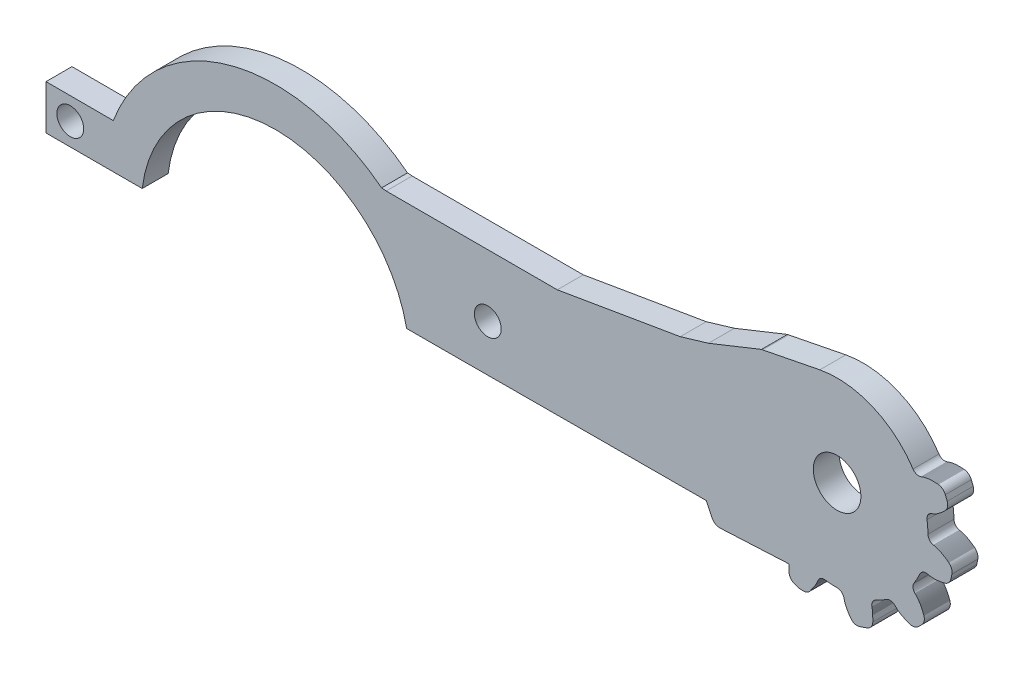
from build123d import *

# Parameters (mm, degrees)
MODEL_R         = 1.55
EXTRUDE_3_DEPTH = 3


with BuildPart() as part:
    # Model → 凸台-拉伸3 (new body)
    with BuildSketch(Plane.XY):
        with BuildLine():
            Line((3158.977966711, 1766.810791231), (3159.006533739, 1766.840009937))
            Line((3159.006533739, 1766.840009937), (3159.034921501, 1766.869406555))
            ThreePointArc((3159.034921501, 1766.869406555), (3159.291052878, 1767.351449245), (3159.255884769, 1767.896180042))
            ThreePointArc((3159.255884769, 1767.896180042), (3159.153973649, 1768.173760338), (3159.046007365, 1768.449041974))
            ThreePointArc((3159.046007365, 1768.449041974), (3158.710829011, 1768.879882905), (3158.199335085, 1769.070519737))
            Line((3158.199335085, 1769.070519737), (3158.15859093, 1769.073672502))
            Line((3158.15859093, 1769.073672502), (3158.117830731, 1769.076573212))
            Line((3158.117830731, 1769.076573212), (3158.077056286, 1769.079221517))
            Line((3158.077056286, 1769.079221517), (3158.036268646, 1769.081615765))
            Line((3158.036268646, 1769.081615765), (3157.995468742, 1769.083754099))
            Line((3157.995468742, 1769.083754099), (3157.954657508, 1769.085634662))
            Line((3157.954657508, 1769.085634662), (3157.913835876, 1769.087255598))
            Line((3157.913835876, 1769.087255598), (3157.873004779, 1769.088615048))
            Line((3157.873004779, 1769.088615048), (3157.832165149, 1769.089711156))
            Line((3157.832165149, 1769.089711156), (3157.791317919, 1769.090542065))
            Line((3157.791317919, 1769.090542065), (3157.750464022, 1769.091105918))
            Line((3157.750464022, 1769.091105918), (3157.70960439, 1769.091400858))
            Line((3157.70960439, 1769.091400858), (3157.668739956, 1769.091425028))
            Line((3157.668739956, 1769.091425028), (3157.627871653, 1769.091176571))
            Line((3157.627871653, 1769.091176571), (3157.587000413, 1769.090653629))
            Line((3157.587000413, 1769.090653629), (3157.546127169, 1769.089854346))
            Line((3157.546127169, 1769.089854346), (3157.505252853, 1769.088776865))
            Line((3157.505252853, 1769.088776865), (3157.464378398, 1769.087419329))
            Line((3157.464378398, 1769.087419329), (3157.423505499, 1769.085777687))
            Line((3157.423505499, 1769.085777687), (3157.38263957, 1769.083837181))
            Line((3157.38263957, 1769.083837181), (3157.341787157, 1769.081579793))
            Line((3157.341787157, 1769.081579793), (3157.300954807, 1769.078987503))
            Line((3157.300954807, 1769.078987503), (3157.260149068, 1769.076042291))
            Line((3157.260149068, 1769.076042291), (3157.219376487, 1769.072726138))
            Line((3157.219376487, 1769.072726138), (3157.178643611, 1769.069021024))
            Line((3157.178643611, 1769.069021024), (3157.137956986, 1769.064908929))
            Line((3157.137956986, 1769.064908929), (3157.09732316, 1769.060371834))
            Line((3157.09732316, 1769.060371834), (3157.05674868, 1769.055391718))
            Line((3157.05674868, 1769.055391718), (3157.016240094, 1769.049950563))
            Line((3157.016240094, 1769.049950563), (3156.975803947, 1769.044030348))
            Line((3156.975803947, 1769.044030348), (3156.935446787, 1769.037613055))
            Line((3156.935446787, 1769.037613055), (3156.895175162, 1769.030680662))
            Line((3156.895175162, 1769.030680662), (3156.854995618, 1769.023215151))
            Line((3156.854995618, 1769.023215151), (3156.814914695, 1769.015198994))
            Line((3156.814914695, 1769.015198994), (3156.774938772, 1769.006627541))
            Line((3156.774938772, 1769.006627541), (3156.735074048, 1768.99750997))
            Line((3156.735074048, 1768.99750997), (3156.695326716, 1768.987856136))
            Line((3156.695326716, 1768.987856136), (3156.655702967, 1768.977675895))
            Line((3156.655702967, 1768.977675895), (3156.616208993, 1768.966979103))
            Line((3156.616208993, 1768.966979103), (3156.576850986, 1768.955775615))
            Line((3156.576850986, 1768.955775615), (3156.537635139, 1768.944075289))
            Line((3156.537635139, 1768.944075289), (3156.498567642, 1768.931887979))
            Line((3156.498567642, 1768.931887979), (3156.459654689, 1768.919223542))
            Line((3156.459654689, 1768.919223542), (3156.420902471, 1768.906091834))
            Line((3156.420902471, 1768.906091834), (3156.382317179, 1768.89250271))
            Line((3156.382317179, 1768.89250271), (3156.343905007, 1768.878466027))
            Line((3156.343905007, 1768.878466027), (3156.305672145, 1768.863991641))
            Line((3156.305672145, 1768.863991641), (3156.267624786, 1768.849089407))
            ThreePointArc((3156.267624786, 1768.849089407), (3156.102552627, 1768.803156848), (3155.931480169, 1768.793521929))
            ThreePointArc((3155.931480169, 1768.793521929), (3155.575765967, 1768.898024759), (3155.305665417, 1769.151991542))
            ThreePointArc((3155.305665417, 1769.151991542), (3150.611697753, 1773.057874001), (3144.538148034, 1773.691312259))
            Line((3144.538148034, 1773.691312259), (3137.923574677, 1772.38248648))
            ThreePointArc((3137.923574677, 1772.38248648), (3137.862754185, 1772.372389298), (3137.801427059, 1772.366059292))
            Line((3137.801427059, 1772.366059292), (3131.669869487, 1769.91654616))
            Line((3131.669869487, 1769.91654616), (3128.4128753, 1768.946597823))
            Line((3128.4128753, 1768.946597823), (3114.205961715, 1766.532320414))
            Line((3114.205961715, 1766.532320414), (3094.433280611, 1766.532320414))
            Line((3094.433280611, 1766.532320414), (3093.904446802, 1766.580993594))
            ThreePointArc((3093.904446802, 1766.580993594), (3076.188230883, 1770.035752188), (3062.904521532, 1757.815165898))
            Line((3062.904521532, 1757.815165898), (3055.130304412, 1757.827990225))
            Line((3055.130304412, 1757.827990225), (3055.130304412, 1752.685054998))
            Line((3055.130304412, 1752.685054998), (3061.720181249, 1752.685054998))
            Line((3061.720181249, 1752.685054998), (3066.246469955, 1752.685054998))
            ThreePointArc((3066.246469955, 1752.685054998), (3080.986097034, 1766.276983296), (3096.803522292, 1753.956018257))
            Line((3096.803522292, 1753.956018257), (3101.378030798, 1753.956522823))
            Line((3101.378030798, 1753.956522823), (3131.421318555, 1754.049099647))
            Line((3131.421318555, 1754.049099647), (3132.145372205, 1752.548482232))
            ThreePointArc((3132.145372205, 1752.548482232), (3132.484712735, 1752.225716316), (3132.933796063, 1752.092847974))
            ThreePointArc((3132.933796063, 1752.092847974), (3132.984313262, 1752.091532482), (3133.034832414, 1752.09277068))
            Line((3133.034832414, 1752.09277068), (3140.958950813, 1752.487535322))
            Line((3140.958950813, 1752.487535322), (3140.958059775, 1752.467097369))
            Line((3140.958059775, 1752.467097369), (3140.956594717, 1752.426211634))
            Line((3140.956594717, 1752.426211634), (3140.955428582, 1752.385322405))
            Line((3140.955428582, 1752.385322405), (3140.954546553, 1752.344434926))
            Line((3140.954546553, 1752.344434926), (3140.953944558, 1752.303550842))
            Line((3140.953944558, 1752.303550842), (3140.953620731, 1752.262671066))
            Line((3140.953620731, 1752.262671066), (3140.953573202, 1752.221796509))
            Line((3140.953573202, 1752.221796509), (3140.953800105, 1752.18092808))
            Line((3140.953800105, 1752.18092808), (3140.954299572, 1752.140066691))
            Line((3140.954299572, 1752.140066691), (3140.955069734, 1752.099213254))
            Line((3140.955069734, 1752.099213254), (3140.956108725, 1752.058368678))
            Line((3140.956108725, 1752.058368678), (3140.957414677, 1752.017533876))
            Line((3140.957414677, 1752.017533876), (3140.958985721, 1751.976709758))
            Line((3140.958985721, 1751.976709758), (3140.96081999, 1751.935897234))
            Line((3140.96081999, 1751.935897234), (3140.962915616, 1751.895097217))
            Line((3140.962915616, 1751.895097217), (3140.965270732, 1751.854310617))
            Line((3140.965270732, 1751.854310617), (3140.967883469, 1751.813538344))
            Line((3140.967883469, 1751.813538344), (3140.970751961, 1751.77278131))
            Line((3140.970751961, 1751.77278131), (3140.973874338, 1751.732040426))
            Line((3140.973874338, 1751.732040426), (3140.977248938, 1751.691316723))
            Line((3140.977248938, 1751.691316723), (3140.980875389, 1751.650611994))
            ThreePointArc((3140.980875389, 1751.650611994), (3141.177448565, 1751.141369985), (3141.612158847, 1750.811225459))
            ThreePointArc((3141.612158847, 1750.811225459), (3141.850146516, 1750.720651457), (3142.089800203, 1750.634582354))
            ThreePointArc((3142.089800203, 1750.634582354), (3142.344045808, 1750.620406585), (3142.59851356, 1750.611028772))
            ThreePointArc((3142.59851356, 1750.611028772), (3143.127538852, 1750.745567532), (3143.507096024, 1751.137874542))
            Line((3143.507096024, 1751.137874542), (3144.011634077, 1751.854069451))
            Line((3144.011634077, 1751.854069451), (3144.030843181, 1751.890139335))
            Line((3144.030843181, 1751.890139335), (3144.04982776, 1751.92632488))
            Line((3144.04982776, 1751.92632488), (3144.068586774, 1751.96262458))
            Line((3144.068586774, 1751.96262458), (3144.087118288, 1751.999038136))
            Line((3144.087118288, 1751.999038136), (3144.105420227, 1752.035565435))
            Line((3144.105420227, 1752.035565435), (3144.123490517, 1752.072206369))
            Line((3144.123490517, 1752.072206369), (3144.141327081, 1752.108960825))
            Line((3144.141327081, 1752.108960825), (3144.158927846, 1752.145828693))
            Line((3144.158927846, 1752.145828693), (3144.176290735, 1752.182809862))
            Line((3144.176290735, 1752.182809862), (3144.193413674, 1752.219904222))
            Line((3144.193413674, 1752.219904222), (3144.210294587, 1752.257111662))
            Line((3144.210294587, 1752.257111662), (3144.2269314, 1752.294432072))
            Line((3144.2269314, 1752.294432072), (3144.243322037, 1752.33186534))
            Line((3144.243322037, 1752.33186534), (3144.259464423, 1752.369411356))
            Line((3144.259464423, 1752.369411356), (3144.275356484, 1752.407070009))
            Line((3144.275356484, 1752.407070009), (3144.290996143, 1752.444841189))
            Line((3144.290996143, 1752.444841189), (3144.306381326, 1752.482724784))
            Line((3144.306381326, 1752.482724784), (3144.321509959, 1752.520720684))
            Line((3144.321509959, 1752.520720684), (3144.328943804, 1752.539774822))
            ThreePointArc((3144.328943804, 1752.539774822), (3144.668940877, 1752.888173571), (3145.148081398, 1752.974220412))
            ThreePointArc((3145.148081398, 1752.974220412), (3145.570425083, 1752.926708994), (3145.994345511, 1752.896328167))
            ThreePointArc((3145.994345511, 1752.896328167), (3146.269233955, 1752.885821127), (3146.54430331, 1752.88251887))
            ThreePointArc((3146.54430331, 1752.88251887), (3147.04876035, 1752.70355742), (3147.326650652, 1752.246084922))
            Line((3147.326650652, 1752.246084922), (3147.335149498, 1752.206116839))
            Line((3147.335149498, 1752.206116839), (3147.344107656, 1752.16622936))
            Line((3147.344107656, 1752.16622936), (3147.353529947, 1752.12643308))
            Line((3147.353529947, 1752.12643308), (3147.363421192, 1752.086738593))
            Line((3147.363421192, 1752.086738593), (3147.373786212, 1752.047156495))
            Line((3147.373786212, 1752.047156495), (3147.384629827, 1752.007697378))
            Line((3147.384629827, 1752.007697378), (3147.395956859, 1751.968371837))
            Line((3147.395956859, 1751.968371837), (3147.407772127, 1751.929190467))
            Line((3147.407772127, 1751.929190467), (3147.420080454, 1751.890163862))
            Line((3147.420080454, 1751.890163862), (3147.43288666, 1751.851302616))
            Line((3147.43288666, 1751.851302616), (3147.446195565, 1751.812617323))
            Line((3147.446195565, 1751.812617323), (3147.460011991, 1751.774118579))
            Line((3147.460011991, 1751.774118579), (3147.474340758, 1751.735816976))
            Line((3147.474340758, 1751.735816976), (3147.489186687, 1751.69772311))
            Line((3147.489186687, 1751.69772311), (3147.504554027, 1751.659847208))
            Line((3147.504554027, 1751.659847208), (3147.520435386, 1751.622192035))
            Line((3147.520435386, 1751.622192035), (3147.536812532, 1751.584753406))
            Line((3147.536812532, 1751.584753406), (3147.553666814, 1751.547526867))
            Line((3147.553666814, 1751.547526867), (3147.570979586, 1751.510507969))
            Line((3147.570979586, 1751.510507969), (3147.588732199, 1751.473692259))
            Line((3147.588732199, 1751.473692259), (3147.606906004, 1751.437075285))
            Line((3147.606906004, 1751.437075285), (3147.625482354, 1751.400652596))
            Line((3147.625482354, 1751.400652596), (3147.6444426, 1751.364419741))
            Line((3147.6444426, 1751.364419741), (3147.663768095, 1751.328372267))
            Line((3147.663768095, 1751.328372267), (3147.683440189, 1751.292505723))
            Line((3147.683440189, 1751.292505723), (3147.703440235, 1751.256815658))
            Line((3147.703440235, 1751.256815658), (3147.723749584, 1751.22129762))
            Line((3147.723749584, 1751.22129762), (3147.744349589, 1751.185947157))
            Line((3147.744349589, 1751.185947157), (3147.765221601, 1751.150759817))
            Line((3147.765221601, 1751.150759817), (3147.786346972, 1751.115731149))
            Line((3147.786346972, 1751.115731149), (3147.807710402, 1751.080857552))
            Line((3147.807710402, 1751.080857552), (3147.829307576, 1751.046138209))
            Line((3147.829307576, 1751.046138209), (3147.85113643, 1751.011572879))
            Line((3147.85113643, 1751.011572879), (3147.873194901, 1750.977161317))
            Line((3147.873194901, 1750.977161317), (3147.895480925, 1750.94290328))
            Line((3147.895480925, 1750.94290328), (3147.917992437, 1750.908798524))
            Line((3147.917992437, 1750.908798524), (3147.940727375, 1750.874846807))
            Line((3147.940727375, 1750.874846807), (3147.963683675, 1750.841047885))
            Line((3147.963683675, 1750.841047885), (3147.986859272, 1750.807401513))
            Line((3147.986859272, 1750.807401513), (3148.010252103, 1750.77390745))
            Line((3148.010252103, 1750.77390745), (3148.033860104, 1750.740565451))
            Line((3148.033860104, 1750.740565451), (3148.057681212, 1750.707375274))
            Line((3148.057681212, 1750.707375274), (3148.081713362, 1750.674336674))
            Line((3148.081713362, 1750.674336674), (3148.105954492, 1750.641449408))
            Line((3148.105954492, 1750.641449408), (3148.130402536, 1750.608713233))
            Line((3148.130402536, 1750.608713233), (3148.155055432, 1750.576127905))
            Line((3148.155055432, 1750.576127905), (3148.179911222, 1750.543693393))
            Line((3148.179911222, 1750.543693393), (3148.204968625, 1750.511411002))
            ThreePointArc((3148.204968625, 1750.511411002), (3148.244535938, 1750.463866673), (3148.286967004, 1750.41885956))
            ThreePointArc((3148.286967004, 1750.41885956), (3148.693644721, 1750.264769442), (3149.127278, 1750.297825584))
            ThreePointArc((3149.127278, 1750.297825584), (3149.574723168, 1750.442751618), (3150.01666422, 1750.603682786))
            ThreePointArc((3150.01666422, 1750.603682786), (3150.477300798, 1750.96214444), (3150.659076592, 1751.516796019))
            Line((3150.659076592, 1751.516796019), (3150.650449261, 1752.243553298))
            Line((3150.650449261, 1752.243553298), (3150.649892313, 1752.280948133))
            Line((3150.649892313, 1752.280948133), (3150.648761732, 1752.321796434))
            Line((3150.648761732, 1752.321796434), (3150.647090355, 1752.362629461))
            Line((3150.647090355, 1752.362629461), (3150.6448599, 1752.403443236))
            Line((3150.6448599, 1752.403443236), (3150.64206486, 1752.444232107))
            Line((3150.64206486, 1752.444232107), (3150.638713434, 1752.484988631))
            Line((3150.638713434, 1752.484988631), (3150.634814498, 1752.525705276))
            Line((3150.634814498, 1752.525705276), (3150.630376924, 1752.566374512))
            Line((3150.630376924, 1752.566374512), (3150.625409588, 1752.606988807))
            Line((3150.625409588, 1752.606988807), (3150.619921364, 1752.647540628))
            Line((3150.619921364, 1752.647540628), (3150.613921127, 1752.688022445))
            Line((3150.613921127, 1752.688022445), (3150.607417751, 1752.728426726))
            Line((3150.607417751, 1752.728426726), (3150.600420111, 1752.768745938))
            Line((3150.600420111, 1752.768745938), (3150.59293708, 1752.808972552))
            Line((3150.59293708, 1752.808972552), (3150.584977534, 1752.849099035))
            Line((3150.584977534, 1752.849099035), (3150.576550346, 1752.889117855))
            Line((3150.576550346, 1752.889117855), (3150.567664391, 1752.929021481))
            Line((3150.567664391, 1752.929021481), (3150.558328544, 1752.968802382))
            ThreePointArc((3150.558328544, 1752.968802382), (3150.614878504, 1753.501067548), (3150.995048665, 1753.877862924))
            ThreePointArc((3150.995048665, 1753.877862924), (3151.618427289, 1754.196304046), (3152.219202878, 1754.555573233))
            ThreePointArc((3152.219202878, 1754.555573233), (3152.74033301, 1754.677751347), (3153.221437513, 1754.443139833))
            Line((3153.221437513, 1754.443139833), (3153.250195575, 1754.414111364))
            Line((3153.250195575, 1754.414111364), (3153.279296456, 1754.385399028))
            Line((3153.279296456, 1754.385399028), (3153.308738485, 1754.357014342))
            Line((3153.308738485, 1754.357014342), (3153.33851999, 1754.328968826))
            Line((3153.33851999, 1754.328968826), (3153.368639297, 1754.301273998))
            Line((3153.368639297, 1754.301273998), (3153.399094736, 1754.273941377))
            Line((3153.399094736, 1754.273941377), (3153.429884634, 1754.246982483))
            Line((3153.429884634, 1754.246982483), (3153.461007318, 1754.220408833))
            Line((3153.461007318, 1754.220408833), (3153.492461117, 1754.194231948))
            Line((3153.492461117, 1754.194231948), (3153.524244359, 1754.168463345))
            Line((3153.524244359, 1754.168463345), (3153.55635537, 1754.143114543))
            Line((3153.55635537, 1754.143114543), (3153.58879248, 1754.118197062))
            Line((3153.58879248, 1754.118197062), (3153.621554016, 1754.09372242))
            Line((3153.621554016, 1754.09372242), (3153.654638305, 1754.069702136))
            Line((3153.654638305, 1754.069702136), (3153.688043392, 1754.046147111))
            Line((3153.688043392, 1754.046147111), (3153.721761566, 1754.023055675))
            Line((3153.721761566, 1754.023055675), (3153.755779748, 1754.000414448))
            Line((3153.755779748, 1754.000414448), (3153.790084659, 1753.978209605))
            Line((3153.790084659, 1753.978209605), (3153.824663017, 1753.956427317))
            Line((3153.824663017, 1753.956427317), (3153.859501541, 1753.935053757))
            Line((3153.859501541, 1753.935053757), (3153.89458695, 1753.9140751))
            Line((3153.89458695, 1753.9140751), (3153.929905962, 1753.893477517))
            Line((3153.929905962, 1753.893477517), (3153.965445297, 1753.873247183))
            Line((3153.965445297, 1753.873247183), (3154.001191673, 1753.853370269))
            Line((3154.001191673, 1753.853370269), (3154.037131809, 1753.83383295))
            Line((3154.037131809, 1753.83383295), (3154.073252424, 1753.814621397))
            Line((3154.073252424, 1753.814621397), (3154.109540238, 1753.795721785))
            Line((3154.109540238, 1753.795721785), (3154.145981968, 1753.777120287))
            Line((3154.145981968, 1753.777120287), (3154.182564333, 1753.758803074))
            Line((3154.182564333, 1753.758803074), (3154.219274054, 1753.740756322))
            Line((3154.219274054, 1753.740756322), (3154.256100205, 1753.722968727))
            Line((3154.256100205, 1753.722968727), (3154.293039598, 1753.705437272))
            Line((3154.293039598, 1753.705437272), (3154.330090627, 1753.688160635))
            Line((3154.330090627, 1753.688160635), (3154.367251689, 1753.671137496))
            Line((3154.367251689, 1753.671137496), (3154.404521178, 1753.654366536))
            Line((3154.404521178, 1753.654366536), (3154.44189749, 1753.637846432))
            Line((3154.44189749, 1753.637846432), (3154.479379021, 1753.621575866))
            Line((3154.479379021, 1753.621575866), (3154.516964166, 1753.605553515))
            Line((3154.516964166, 1753.605553515), (3154.554651321, 1753.58977806))
            Line((3154.554651321, 1753.58977806), (3154.59243888, 1753.574248181))
            Line((3154.59243888, 1753.574248181), (3154.63032524, 1753.558962555))
            Line((3154.63032524, 1753.558962555), (3154.668308796, 1753.543919864))
            Line((3154.668308796, 1753.543919864), (3154.706387943, 1753.529118787))
            Line((3154.706387943, 1753.529118787), (3154.744561077, 1753.514558002))
            Line((3154.744561077, 1753.514558002), (3154.782826594, 1753.50023619))
            Line((3154.782826594, 1753.50023619), (3154.821182888, 1753.48615203))
            Line((3154.821182888, 1753.48615203), (3154.85962833, 1753.472304436))
            Line((3154.85962833, 1753.472304436), (3154.898161137, 1753.458693816))
            ThreePointArc((3154.898161137, 1753.458693816), (3155.035634373, 1753.421361886), (3155.177017268, 1753.403942332))
            ThreePointArc((3155.177017268, 1753.403942332), (3155.579639798, 1753.46637894), (3155.923938612, 1753.68423568))
            ThreePointArc((3155.923938612, 1753.68423568), (3156.134099121, 1753.892248318), (3156.339653289, 1754.104814027))
            ThreePointArc((3156.339653289, 1754.104814027), (3156.592321865, 1754.588680774), (3156.553248971, 1755.133145416))
            Line((3156.553248971, 1755.133145416), (3156.539191093, 1755.171517309))
            Line((3156.539191093, 1755.171517309), (3156.524897273, 1755.209799089))
            Line((3156.524897273, 1755.209799089), (3156.510367939, 1755.247988974))
            Line((3156.510367939, 1755.247988974), (3156.495602026, 1755.286085323))
            Line((3156.495602026, 1755.286085323), (3156.480598231, 1755.324086517))
            Line((3156.480598231, 1755.324086517), (3156.465355252, 1755.361990936))
            Line((3156.465355252, 1755.361990936), (3156.449871788, 1755.399796959))
            Line((3156.449871788, 1755.399796959), (3156.434146536, 1755.437502968))
            Line((3156.434146536, 1755.437502968), (3156.418178196, 1755.475107341))
            Line((3156.418178196, 1755.475107341), (3156.401965465, 1755.512608461))
            Line((3156.401965465, 1755.512608461), (3156.385507041, 1755.550004706))
            Line((3156.385507041, 1755.550004706), (3156.368801624, 1755.587294456))
            Line((3156.368801624, 1755.587294456), (3156.35184791, 1755.624476093))
            Line((3156.35184791, 1755.624476093), (3156.334644599, 1755.661547997))
            Line((3156.334644599, 1755.661547997), (3156.317190387, 1755.698508547))
            Line((3156.317190387, 1755.698508547), (3156.299483975, 1755.735356124))
            Line((3156.299483975, 1755.735356124), (3156.281524059, 1755.772089107))
            Line((3156.281524059, 1755.772089107), (3156.263309339, 1755.808705878))
            Line((3156.263309339, 1755.808705878), (3156.244836833, 1755.845203212))
            Line((3156.244836833, 1755.845203212), (3156.226095366, 1755.881570054))
            Line((3156.226095366, 1755.881570054), (3156.207071268, 1755.917792963))
            Line((3156.207071268, 1755.917792963), (3156.187750867, 1755.953858498))
            Line((3156.187750867, 1755.953858498), (3156.168120492, 1755.989753218))
            Line((3156.168120492, 1755.989753218), (3156.14816647, 1756.025463683))
            Line((3156.14816647, 1756.025463683), (3156.127875131, 1756.060976451))
            Line((3156.127875131, 1756.060976451), (3156.107232804, 1756.09627808))
            Line((3156.107232804, 1756.09627808), (3156.086225815, 1756.131355131))
            Line((3156.086225815, 1756.131355131), (3156.064840495, 1756.166194161))
            Line((3156.064840495, 1756.166194161), (3156.043063171, 1756.20078173))
            Line((3156.043063171, 1756.20078173), (3156.020880172, 1756.235104397))
            Line((3156.020880172, 1756.235104397), (3155.998277826, 1756.269148721))
            Line((3155.998277826, 1756.269148721), (3155.975242462, 1756.30290126))
            Line((3155.975242462, 1756.30290126), (3155.951760409, 1756.336348573))
            Line((3155.951760409, 1756.336348573), (3155.927818439, 1756.36947743))
            Line((3155.927818439, 1756.36947743), (3155.903414973, 1756.402280099))
            Line((3155.903414973, 1756.402280099), (3155.878560933, 1756.434754752))
            Line((3155.878560933, 1756.434754752), (3155.853267858, 1756.466899849))
            Line((3155.853267858, 1756.466899849), (3155.827547285, 1756.498713854))
            Line((3155.827547285, 1756.498713854), (3155.801410751, 1756.530195228))
            Line((3155.801410751, 1756.530195228), (3155.774869793, 1756.561342434))
            Line((3155.774869793, 1756.561342434), (3155.74793595, 1756.592153932))
            Line((3155.74793595, 1756.592153932), (3155.720620759, 1756.622628185))
            Line((3155.720620759, 1756.622628185), (3155.692935757, 1756.652763655))
            Line((3155.692935757, 1756.652763655), (3155.664892481, 1756.682558804))
            Line((3155.664892481, 1756.682558804), (3155.636502471, 1756.712012094))
            Line((3155.636502471, 1756.712012094), (3155.607777261, 1756.741121986))
            Line((3155.607777261, 1756.741121986), (3155.578728392, 1756.769886943))
            Line((3155.578728392, 1756.769886943), (3155.549367399, 1756.798305426))
            ThreePointArc((3155.549367399, 1756.798305426), (3155.309175978, 1757.276648595), (3155.425284509, 1757.799164542))
            ThreePointArc((3155.425284509, 1757.799164542), (3155.77754171, 1758.404078189), (3156.08871071, 1759.031118468))
            ThreePointArc((3156.08871071, 1759.031118468), (3156.461058798, 1759.415645459), (3156.992630222, 1759.478382425))
            Line((3156.992630222, 1759.478382425), (3157.032517018, 1759.469509906))
            Line((3157.032517018, 1759.469509906), (3157.072521298, 1759.461088675))
            Line((3157.072521298, 1759.461088675), (3157.112635429, 1759.453127521))
            Line((3157.112635429, 1759.453127521), (3157.152851776, 1759.445635228))
            Line((3157.152851776, 1759.445635228), (3157.193162704, 1759.438620583))
            Line((3157.193162704, 1759.438620583), (3157.23356058, 1759.432092373))
            Line((3157.23356058, 1759.432092373), (3157.274037769, 1759.426059383))
            Line((3157.274037769, 1759.426059383), (3157.314586637, 1759.4205304))
            Line((3157.314586637, 1759.4205304), (3157.355199549, 1759.41551421))
            Line((3157.355199549, 1759.41551421), (3157.395868872, 1759.4110196))
            Line((3157.395868872, 1759.4110196), (3157.436586971, 1759.407055354))
            Line((3157.436586971, 1759.407055354), (3157.477346211, 1759.403630261))
            Line((3157.477346211, 1759.403630261), (3157.518138959, 1759.400753105))
            Line((3157.518138959, 1759.400753105), (3157.55895758, 1759.398432674))
            Line((3157.55895758, 1759.398432674), (3157.599794537, 1759.396677079))
            Line((3157.599794537, 1759.396677079), (3157.640644242, 1759.395480748))
            Line((3157.640644242, 1759.395480748), (3157.681502929, 1759.394825355))
            Line((3157.681502929, 1759.394825355), (3157.722366902, 1759.394692086))
            Line((3157.722366902, 1759.394692086), (3157.763232461, 1759.395062131))
            Line((3157.763232461, 1759.395062131), (3157.804095911, 1759.395916677))
            Line((3157.804095911, 1759.395916677), (3157.844953554, 1759.397236911))
            Line((3157.844953554, 1759.397236911), (3157.885801691, 1759.399004022))
            Line((3157.885801691, 1759.399004022), (3157.926636627, 1759.401199196))
            Line((3157.926636627, 1759.401199196), (3157.967454663, 1759.403803623))
            Line((3157.967454663, 1759.403803623), (3158.008252102, 1759.406798488))
            Line((3158.008252102, 1759.406798488), (3158.049025246, 1759.410164981))
            Line((3158.049025246, 1759.410164981), (3158.089770399, 1759.413884289))
            Line((3158.089770399, 1759.413884289), (3158.130483863, 1759.417937599))
            Line((3158.130483863, 1759.417937599), (3158.17116194, 1759.422306099))
            Line((3158.17116194, 1759.422306099), (3158.211800933, 1759.426970979))
            Line((3158.211800933, 1759.426970979), (3158.252397763, 1759.431916822))
            Line((3158.252397763, 1759.431916822), (3158.292951378, 1759.437139367))
            Line((3158.292951378, 1759.437139367), (3158.333461142, 1759.442636634))
            Line((3158.333461142, 1759.442636634), (3158.37392642, 1759.448406645))
            Line((3158.37392642, 1759.448406645), (3158.414346575, 1759.454447422))
            Line((3158.414346575, 1759.454447422), (3158.454720972, 1759.460756987))
            Line((3158.454720972, 1759.460756987), (3158.495048975, 1759.467333361))
            Line((3158.495048975, 1759.467333361), (3158.535329948, 1759.474174565))
            Line((3158.535329948, 1759.474174565), (3158.575563254, 1759.481278622))
            Line((3158.575563254, 1759.481278622), (3158.615748259, 1759.488643553))
            Line((3158.615748259, 1759.488643553), (3158.655884326, 1759.49626738))
            Line((3158.655884326, 1759.49626738), (3158.69597082, 1759.504148123))
            Line((3158.69597082, 1759.504148123), (3158.736007103, 1759.512283806))
            Line((3158.736007103, 1759.512283806), (3158.775992542, 1759.520672449))
            Line((3158.775992542, 1759.520672449), (3158.815926499, 1759.529312074))
            Line((3158.815926499, 1759.529312074), (3158.855808338, 1759.538200703))
            Line((3158.855808338, 1759.538200703), (3158.895637277, 1759.547336541))
            Line((3158.895637277, 1759.547336541), (3158.935411594, 1759.556718967))
            ThreePointArc((3158.935411594, 1759.556718967), (3159.411494974, 1759.823764006), (3159.676413381, 1760.301034029))
            Line((3159.676413381, 1760.301034029), (3159.798753, 1760.879599373))
            ThreePointArc((3159.798753, 1760.879599373), (3159.749713219, 1761.423256928), (3159.4224832, 1761.86016533))
            Line((3159.4224832, 1761.86016533), (3159.389911548, 1761.884845558))
            Line((3159.389911548, 1761.884845558), (3159.357190129, 1761.909322418))
            Line((3159.357190129, 1761.909322418), (3159.324320265, 1761.933594643))
            Line((3159.324320265, 1761.933594643), (3159.291301947, 1761.957660276))
            Line((3159.291301947, 1761.957660276), (3159.258134954, 1761.98151725))
            Line((3159.258134954, 1761.98151725), (3159.224819069, 1762.0051635))
            Line((3159.224819069, 1762.0051635), (3159.19135407, 1762.028596958))
            Line((3159.19135407, 1762.028596958), (3159.15773974, 1762.051815558))
            Line((3159.15773974, 1762.051815558), (3159.123975858, 1762.074817234))
            Line((3159.123975858, 1762.074817234), (3159.090062205, 1762.097599919))
            Line((3159.090062205, 1762.097599919), (3159.055998562, 1762.120161546))
            Line((3159.055998562, 1762.120161546), (3159.021784709, 1762.14250005))
            Line((3159.021784709, 1762.14250005), (3158.987420426, 1762.164613364))
            Line((3158.987420426, 1762.164613364), (3158.952905496, 1762.186499421))
            Line((3158.952905496, 1762.186499421), (3158.918239697, 1762.208156156))
            Line((3158.918239697, 1762.208156156), (3158.883422811, 1762.2295815))
            Line((3158.883422811, 1762.2295815), (3158.848454618, 1762.250773389))
            Line((3158.848454618, 1762.250773389), (3158.813334899, 1762.271729756))
            Line((3158.813334899, 1762.271729756), (3158.77806289, 1762.292446276))
            Line((3158.77806289, 1762.292446276), (3158.742635166, 1762.312907608))
            Line((3158.742635166, 1762.312907608), (3158.707047493, 1762.333095055))
            Line((3158.707047493, 1762.333095055), (3158.671295637, 1762.352989916))
            Line((3158.671295637, 1762.352989916), (3158.635375363, 1762.372573494))
            Line((3158.635375363, 1762.372573494), (3158.599282437, 1762.39182709))
            Line((3158.599282437, 1762.39182709), (3158.563012625, 1762.410732006))
            Line((3158.563012625, 1762.410732006), (3158.526561692, 1762.429269541))
            Line((3158.526561692, 1762.429269541), (3158.489925404, 1762.447420998))
            Line((3158.489925404, 1762.447420998), (3158.453099525, 1762.465167679))
            Line((3158.453099525, 1762.465167679), (3158.416079823, 1762.482490883))
            Line((3158.416079823, 1762.482490883), (3158.378862062, 1762.499371913))
            Line((3158.378862062, 1762.499371913), (3158.341442008, 1762.51579207))
            Line((3158.341442008, 1762.51579207), (3158.303815426, 1762.531732655))
            Line((3158.303815426, 1762.531732655), (3158.265978083, 1762.547174969))
            Line((3158.265978083, 1762.547174969), (3158.227926004, 1762.562100731))
            Line((3158.227926004, 1762.562100731), (3158.18966204, 1762.576502582))
            Line((3158.18966204, 1762.576502582), (3158.151196369, 1762.59038489))
            Line((3158.151196369, 1762.59038489), (3158.112539529, 1762.603752598))
            Line((3158.112539529, 1762.603752598), (3158.073702056, 1762.61661065))
            Line((3158.073702056, 1762.61661065), (3158.034694488, 1762.62896399))
            Line((3158.034694488, 1762.62896399), (3157.995527363, 1762.640817562))
            Line((3157.995527363, 1762.640817562), (3157.956211219, 1762.652176309))
            Line((3157.956211219, 1762.652176309), (3157.916756593, 1762.663045175))
            Line((3157.916756593, 1762.663045175), (3157.877174022, 1762.673429103))
            Line((3157.877174022, 1762.673429103), (3157.837474043, 1762.683333038))
            Line((3157.837474043, 1762.683333038), (3157.797667196, 1762.692761923))
            Line((3157.797667196, 1762.692761923), (3157.757764016, 1762.701720702))
            Line((3157.757764016, 1762.701720702), (3157.717775042, 1762.710214319))
            Line((3157.717775042, 1762.710214319), (3157.677710811, 1762.718247718))
            ThreePointArc((3157.677710811, 1762.718247718), (3157.217037088, 1762.990798312), (3157.032220351, 1763.493139709))
            ThreePointArc((3157.032220351, 1763.493139709), (3157.001516957, 1764.192470074), (3156.924285409, 1764.888200585))
            ThreePointArc((3156.924285409, 1764.888200585), (3157.029633567, 1765.41299185), (3157.442901741, 1765.753158754))
            Line((3157.442901741, 1765.753158754), (3157.481253495, 1765.767259145))
            Line((3157.481253495, 1765.767259145), (3157.519460098, 1765.781802703))
            Line((3157.519460098, 1765.781802703), (3157.557510377, 1765.79679269))
            Line((3157.557510377, 1765.79679269), (3157.59539316, 1765.81223237))
            Line((3157.59539316, 1765.81223237), (3157.633097274, 1765.828125009))
            Line((3157.633097274, 1765.828125009), (3157.670611547, 1765.84447387))
            Line((3157.670611547, 1765.84447387), (3157.707924806, 1765.861282216))
            Line((3157.707924806, 1765.861282216), (3157.745025878, 1765.878553313))
            Line((3157.745025878, 1765.878553313), (3157.781903591, 1765.896290424))
            Line((3157.781903591, 1765.896290424), (3157.818546772, 1765.914496812))
            Line((3157.818546772, 1765.914496812), (3157.85494425, 1765.933175743))
            Line((3157.85494425, 1765.933175743), (3157.89108485, 1765.95233048))
            Line((3157.89108485, 1765.95233048), (3157.926957401, 1765.971964287))
            Line((3157.926957401, 1765.971964287), (3157.96255073, 1765.992080429))
            Line((3157.96255073, 1765.992080429), (3157.99785411, 1766.012681654))
            Line((3157.99785411, 1766.012681654), (3158.032865854, 1766.033760254))
            Line((3158.032865854, 1766.033760254), (3158.067592702, 1766.055298776))
            Line((3158.067592702, 1766.055298776), (3158.102041713, 1766.077279396))
            Line((3158.102041713, 1766.077279396), (3158.136219948, 1766.099684287))
            Line((3158.136219948, 1766.099684287), (3158.170134468, 1766.122495625))
            Line((3158.170134468, 1766.122495625), (3158.203792331, 1766.145695586))
            Line((3158.203792331, 1766.145695586), (3158.237200599, 1766.169266345))
            Line((3158.237200599, 1766.169266345), (3158.270366332, 1766.193190076))
            Line((3158.270366332, 1766.193190076), (3158.30329659, 1766.217448955))
            Line((3158.30329659, 1766.217448955), (3158.335998433, 1766.242025157))
            Line((3158.335998433, 1766.242025157), (3158.368478921, 1766.266900857))
            Line((3158.368478921, 1766.266900857), (3158.400745116, 1766.292058231))
            Line((3158.400745116, 1766.292058231), (3158.432804076, 1766.317479453))
            Line((3158.432804076, 1766.317479453), (3158.464662862, 1766.343146698))
            Line((3158.464662862, 1766.343146698), (3158.496328535, 1766.369042142))
            Line((3158.496328535, 1766.369042142), (3158.527806836, 1766.395151154))
            Line((3158.527806836, 1766.395151154), (3158.559099187, 1766.421469578))
            Line((3158.559099187, 1766.421469578), (3158.590206123, 1766.447995405))
            Line((3158.590206123, 1766.447995405), (3158.621128177, 1766.474726628))
            Line((3158.621128177, 1766.474726628), (3158.651865885, 1766.50166124))
            Line((3158.651865885, 1766.50166124), (3158.682419781, 1766.52879723))
            Line((3158.682419781, 1766.52879723), (3158.712790399, 1766.556132592))
            Line((3158.712790399, 1766.556132592), (3158.742978276, 1766.583665318))
            Line((3158.742978276, 1766.583665318), (3158.772983944, 1766.611393399))
            Line((3158.772983944, 1766.611393399), (3158.802807939, 1766.639314826))
            Line((3158.802807939, 1766.639314826), (3158.832450795, 1766.667427593))
            Line((3158.832450795, 1766.667427593), (3158.861913048, 1766.695729691))
            Line((3158.861913048, 1766.695729691), (3158.891195231, 1766.724219112))
            Line((3158.891195231, 1766.724219112), (3158.920297879, 1766.752893848))
            Line((3158.920297879, 1766.752893848), (3158.949221528, 1766.78175189))
            Line((3158.949221528, 1766.78175189), (3158.977966711, 1766.810791231))
        make_face()
        with Locations((3057.934992094, 1755.267724772)):
            Circle(MODEL_R, mode=Mode.SUBTRACT)
        with Locations((3106.175635067, 1759.36449905)):
            Circle(MODEL_R, mode=Mode.SUBTRACT)
        with BuildLine():
            ThreePointArc((3146.532803147, 1766.132512572), (3147.244555521, 1766.038808594), (3147.907803147, 1765.764082432))
            ThreePointArc((3147.907803147, 1765.764082432), (3148.914373007, 1764.757512572), (3149.282803147, 1763.382512572))
            ThreePointArc((3149.282803147, 1763.382512572), (3148.914373007, 1762.007512572), (3147.907803147, 1761.000942711))
            ThreePointArc((3147.907803147, 1761.000942711), (3147.244555521, 1760.726216549), (3146.532803147, 1760.632512572))
            ThreePointArc((3146.532803147, 1760.632512572), (3145.821050773, 1760.726216549), (3145.157803147, 1761.000942711))
            ThreePointArc((3145.157803147, 1761.000942711), (3144.151233286, 1762.007512572), (3143.782803147, 1763.382512572))
            ThreePointArc((3143.782803147, 1763.382512572), (3144.151233286, 1764.757512572), (3145.157803147, 1765.764082432))
            ThreePointArc((3145.157803147, 1765.764082432), (3145.821050773, 1766.038808594), (3146.532803147, 1766.132512572))
        make_face(mode=Mode.SUBTRACT)
    extrude(amount=EXTRUDE_3_DEPTH)


solid = part.part
